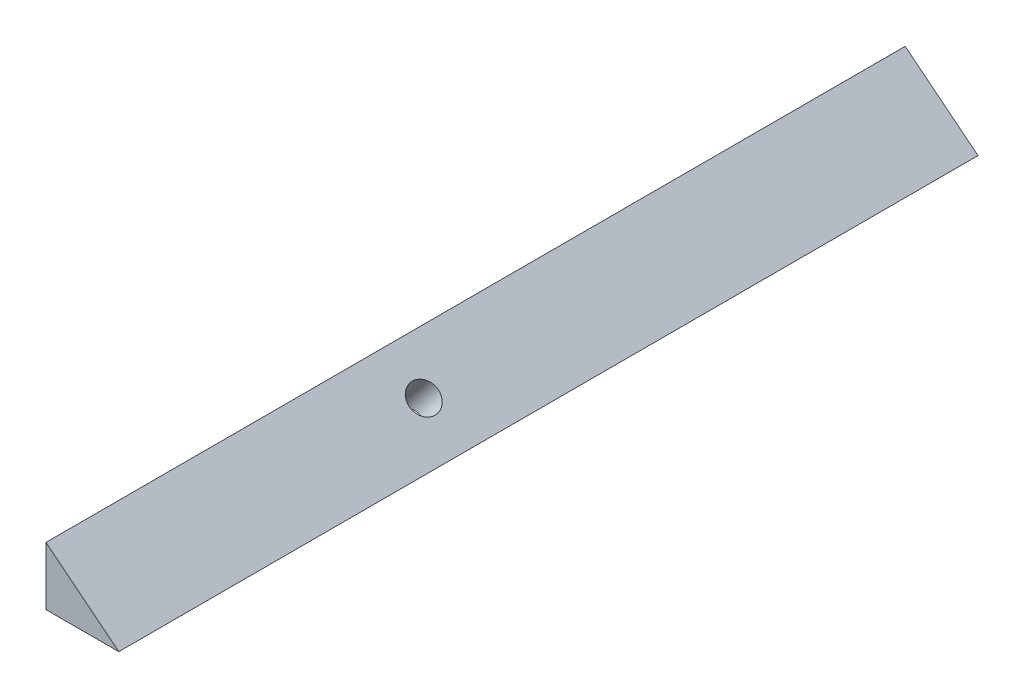
from build123d import *

# Parameters (mm, degrees)
BOSS_EXTRUDE1_DEPTH = 38.1
SKETCH2_R           = 12.7
CUT_EXTRUDE1_DEPTH  = 63.532383805
BOSS_EXTRUDE2_DEPTH = 279.4
BOSS_EXTRUDE3_DEPTH = 431.8


with BuildPart() as part:
    # Sketch1 → Boss-Extrude1 (new body)
    with BuildSketch(Plane.XY):
        Polygon((0, 0), (63.5, 0), (0, 50.8), align=None)
    extrude(amount=-BOSS_EXTRUDE1_DEPTH)

    # Sketch2 → Cut-Extrude1 (cut, through all)
    with BuildSketch(Plane(origin=(24.780487805, 30.975609756, 0), x_dir=(0.7808688094430303, -0.6246950475544244, 0), z_dir=(0.6246950475544244, 0.7808688094430304, 0))):
        with Locations((7.971690031, 19.05)):
            Circle(SKETCH2_R)
    extrude(amount=-CUT_EXTRUDE1_DEPTH, mode=Mode.SUBTRACT)

    # Sketch3 → Boss-Extrude2 (add)
    with BuildSketch(Plane.XY):
        Polygon((0, 50.8), (0, 0), (63.5, 0), align=None)
    extrude(amount=BOSS_EXTRUDE2_DEPTH)

    # Sketch4 → Boss-Extrude3 (add)
    with BuildSketch(Plane(origin=(0, 0, -38.1), x_dir=(-1, 0, 0), z_dir=(0, 0, -1))):
        Polygon((0, 50.8), (-63.5, 0), (0, 0), align=None)
    extrude(amount=BOSS_EXTRUDE3_DEPTH)


solid = part.part
